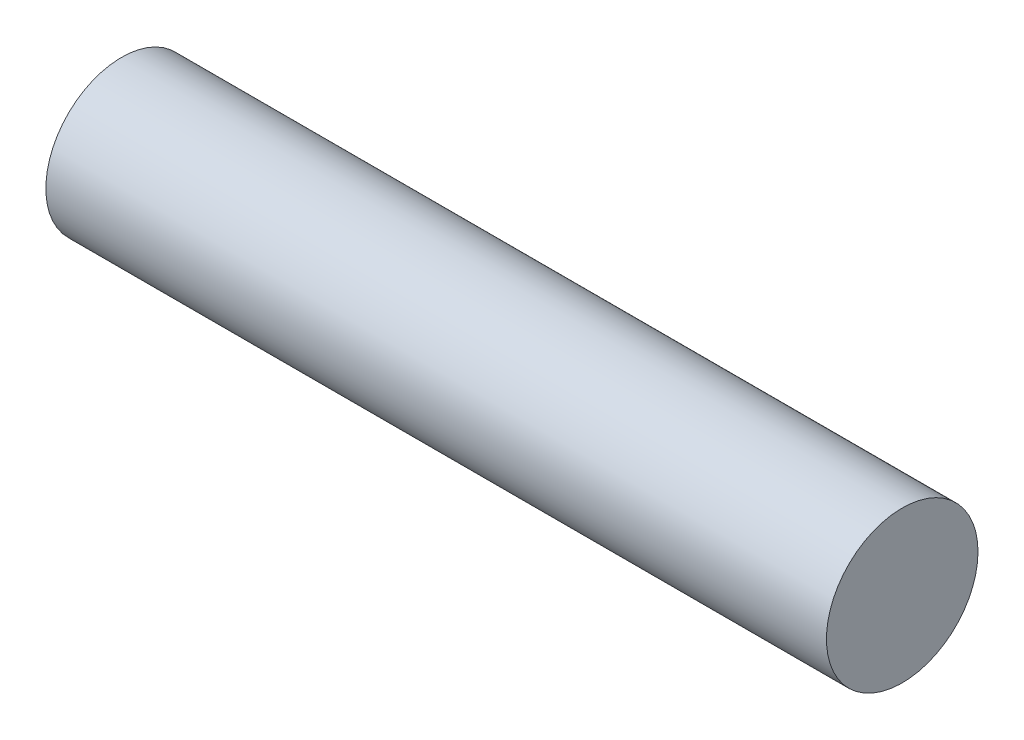
from build123d import *

# Parameters (mm, degrees)
SKETCH1_W               = 396.24
SKETCH1_H               = 19.05
CUT_EXTRUDE1_DEPTH      = 101.6
CUT_EXTRUDE1_DEPTH_BACK = 69.088
F_3DSKETCH2_R           = 25.273
BOSS_EXTRUDE1_DEPTH     = 260.35


with BuildPart() as part:
    # Sketch1 → Revolve1 (revolve)
    with BuildSketch(Plane.XY):
        with Locations((178.556917264, 9.525)):
            Rectangle(SKETCH1_W, SKETCH1_H)
    revolve(axis=Axis((-62.064477949, 19.05, 0), (1, 0, 0)))

    # 3DSketch1 → Cut-Extrude1 (cut, two sides: drawn at the far end of the back side and taken through both)
    with BuildSketch(Plane(origin=(125.15372202, 38.1, 0), x_dir=(-0.9587579392690639, -0.2842238798703196, 0), z_dir=(0, 0, -1)).offset(-CUT_EXTRUDE1_DEPTH_BACK)):
        Polygon((0, 0), (12.838737839, -43.308260512), (158.928287458, 0), (141.370884548, 59.225493089), (-6.410822017, 15.415592494), align=None)
    extrude(amount=CUT_EXTRUDE1_DEPTH + CUT_EXTRUDE1_DEPTH_BACK, mode=Mode.SUBTRACT)

    # 3DSketch2 → Boss-Extrude1 (add)
    with BuildSketch(Plane(origin=(125.15372202, 19.05, 0), x_dir=(0, 0, 1), z_dir=(1, 0, 0))):
        Circle(F_3DSKETCH2_R)
    extrude(amount=BOSS_EXTRUDE1_DEPTH)


solid = part.part
